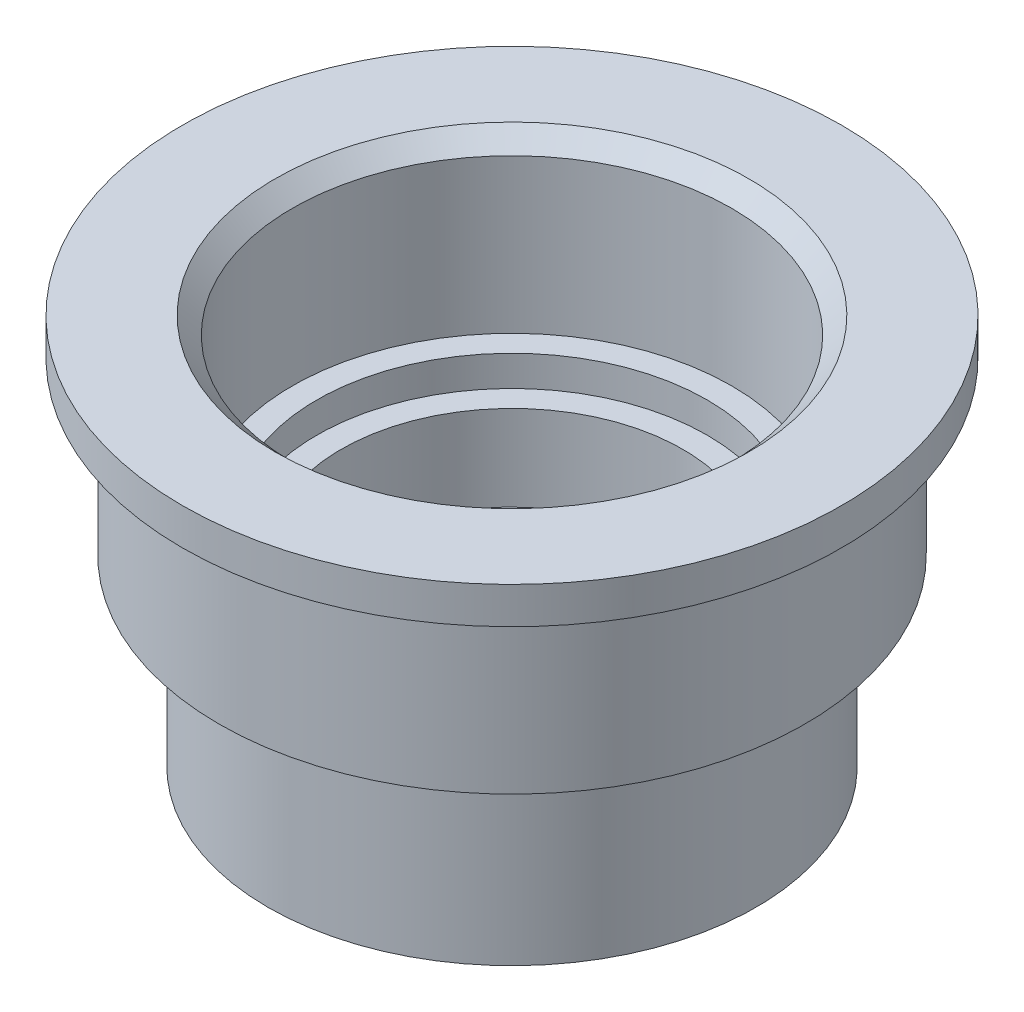
from build123d import *

# Parameters (mm, degrees)
ESQUISSE2_R             = 10
BOSS_EXTRU_1_DEPTH      = 7.5
ESQUISSE3_R             = 12
BOSS_EXTRU_2_DEPTH      = 7
ESQUISSE4_R             = 13.5
BOSS_EXTRU_3_DEPTH      = 1.5
ESQUISSE7_R             = 5.5
ENL_V_MAT_EXTRU_1_DEPTH = 21.5
ESQUISSE8_R             = 9
ENL_V_MAT_EXTRU_2_DEPTH = 7
CHANFREIN1_SIZE         = 0.7
ESQUISSE9_R             = 8
ENL_V_MAT_EXTRU_3_DEPTH = 1.25
ESQUISSE10_R            = 7
ENL_V_MAT_EXTRU_4_DEPTH = 3.5


with BuildPart() as part:
    # Esquisse2 → Boss.-Extru.1 (new body)
    with BuildSketch(Plane(origin=(0, 0, 0), x_dir=(1, 0, 0), z_dir=(0, 1, 0))):
        Circle(ESQUISSE2_R)
    extrude(amount=BOSS_EXTRU_1_DEPTH)

    # Esquisse3 → Boss.-Extru.2 (add)
    with BuildSketch(Plane(origin=(0, 7.5, 0), x_dir=(1, 0, 0), z_dir=(0, 1, 0))):
        Circle(ESQUISSE3_R)
    extrude(amount=BOSS_EXTRU_2_DEPTH)

    # Esquisse4 → Boss.-Extru.3 (add)
    with BuildSketch(Plane(origin=(0, 14.5, 0), x_dir=(1, 0, 0), z_dir=(0, 1, 0))):
        Circle(ESQUISSE4_R)
    extrude(amount=BOSS_EXTRU_3_DEPTH)

    # Esquisse7 → Enlèv. mat.-Extru.1 (cut)
    with BuildSketch(Plane.XZ):
        Circle(ESQUISSE7_R)
    extrude(amount=-ENL_V_MAT_EXTRU_1_DEPTH, mode=Mode.SUBTRACT)

    # Esquisse8 → Enlèv. mat.-Extru.2 (cut)
    with BuildSketch(Plane(origin=(0, 16, 0), x_dir=(1, 0, 0), z_dir=(0, 1, 0))):
        Circle(ESQUISSE8_R)
    extrude(amount=-ENL_V_MAT_EXTRU_2_DEPTH, mode=Mode.SUBTRACT)

    # Chanfrein1
    chanfrein1_edges = [part.edges().sort_by_distance(p)[0] for p in [
        (-9, 16, 0),
    ]]
    chamfer(chanfrein1_edges, length=CHANFREIN1_SIZE)

    # Esquisse9 → Enlèv. mat.-Extru.3 (cut)
    with BuildSketch(Plane(origin=(0, 9, 0), x_dir=(1, 0, 0), z_dir=(0, 1, 0))):
        Circle(ESQUISSE9_R)
    extrude(amount=-ENL_V_MAT_EXTRU_3_DEPTH, mode=Mode.SUBTRACT)

    # Esquisse10 → Enlèv. mat.-Extru.4 (cut)
    with BuildSketch(Plane(origin=(0, 7.75, 0), x_dir=(1, 0, 0), z_dir=(0, 1, 0))):
        Circle(ESQUISSE10_R)
    extrude(amount=-ENL_V_MAT_EXTRU_4_DEPTH, mode=Mode.SUBTRACT)


solid = part.part
